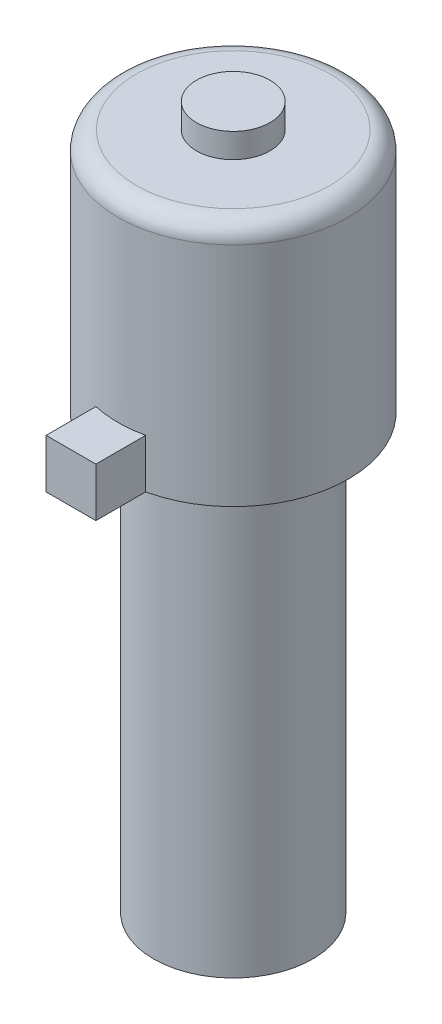
from build123d import *

# Parameters (mm, degrees)
SKETCH1_R           = 3.25
BOSS_EXTRUDE1_DEPTH = 17.686
SKETCH6_R           = 4.7
BOSS_EXTRUDE2_DEPTH = 10
FILLET2_R           = 0.75
SKETCH7_R           = 1.5
BOSS_EXTRUDE3_DEPTH = 1
BOSS_EXTRUDE4_DEPTH = 2


with BuildPart() as part:
    # Sketch1 → Boss-Extrude1 (new body)
    with BuildSketch(Plane(origin=(0, 0, 0), x_dir=(1, 0, 0), z_dir=(0, 1, 0))):
        Circle(SKETCH1_R)
    extrude(amount=BOSS_EXTRUDE1_DEPTH)

    # Sketch6 → Boss-Extrude2 (add)
    with BuildSketch(Plane(origin=(0, 17.686, 0), x_dir=(1, 0, 0), z_dir=(0, 1, 0))):
        Circle(SKETCH6_R)
    extrude(amount=BOSS_EXTRUDE2_DEPTH)

    # Fillet2
    fillet2_edges = [part.edges().sort_by_distance(p)[0] for p in [
        (-4.7, 27.686, 0),
    ]]
    fillet(fillet2_edges, radius=FILLET2_R)

    # Sketch7 → Boss-Extrude3 (add)
    with BuildSketch(Plane(origin=(0, 27.686, 0), x_dir=(1, 0, 0), z_dir=(0, 1, 0))):
        Circle(SKETCH7_R)
    extrude(amount=BOSS_EXTRUDE3_DEPTH)

    # Sketch8 → Boss-Extrude4 (add)
    with BuildSketch(Plane.XZ.offset(-17.686)):
        with BuildLine():
            Line((-1.016, 4.588871757), (-1.016, 6.620871757))
            Line((-1.016, 6.620871757), (1.016, 6.620871757))
            Line((1.016, 6.620871757), (1.016, 4.588871757))
            ThreePointArc((1.016, 4.588871757), (0, 4.7), (-1.016, 4.588871757))
        make_face()
    extrude(amount=-BOSS_EXTRUDE4_DEPTH)


solid = part.part
